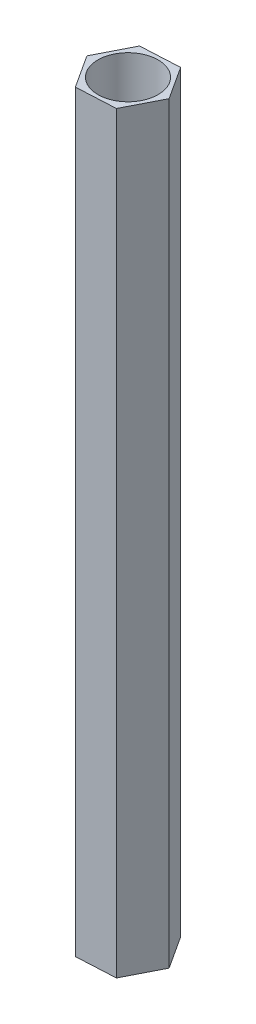
from build123d import *

# Parameters (mm, degrees)
SKETCH1_R           = 2
BOSS_EXTRUDE1_DEPTH = 50


with BuildPart() as part:
    # Sketch1 → Boss-Extrude1 (new body)
    with BuildSketch(Plane(origin=(0, 0, 0), x_dir=(1, 0, 0), z_dir=(0, 1, 0))):
        Polygon((1.413277895, -2.180056328), (2.594623109, 0.133906396), (1.181345214, 2.313962724), (-1.413277895, 2.180056328), (-2.594623109, -0.133906396), (-1.181345214, -2.313962724), align=None)
        Circle(SKETCH1_R, mode=Mode.SUBTRACT)
    extrude(amount=BOSS_EXTRUDE1_DEPTH)


solid = part.part
